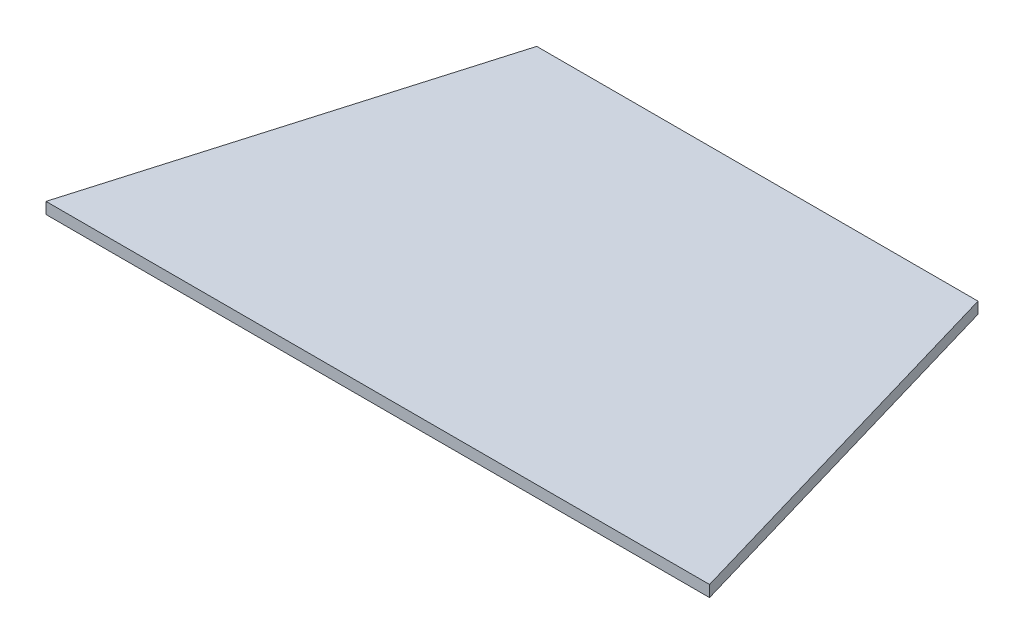
from build123d import *

# Parameters (mm, degrees)
BOSS_EXTRUDE1_DEPTH = 3


with BuildPart() as part:
    # Sketch1 → Boss-Extrude1 (new body)
    with BuildSketch(Plane(origin=(0, 0, 0), x_dir=(1, 0, 0), z_dir=(0, 1, 0))):
        Polygon((5.2, 0), (180, 0), (150.720058283, 100), (34.479941717, 100), align=None)
    extrude(amount=BOSS_EXTRUDE1_DEPTH)


solid = part.part
